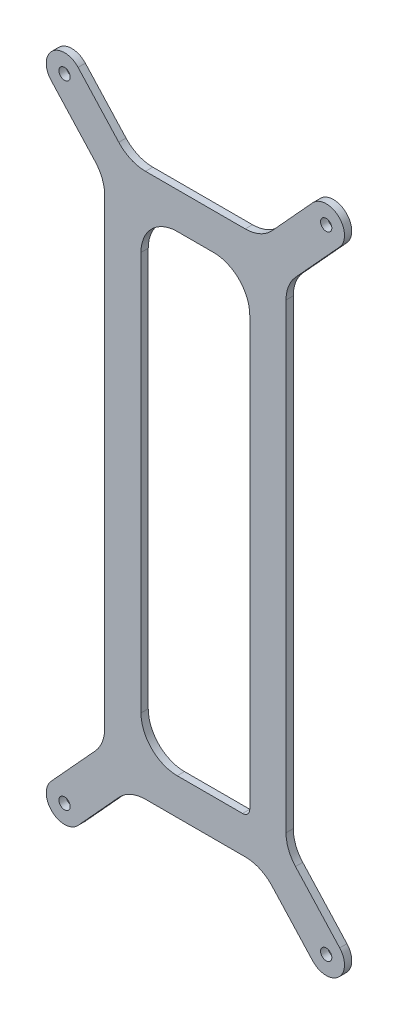
from build123d import *

# Parameters (mm, degrees)
SKETCH1_R           = 1.55
BOSS_EXTRUDE1_DEPTH = 2


with BuildPart() as part:
    # Sketch1 → Boss-Extrude1 (new body)
    with BuildSketch(Plane.XY):
        with BuildLine():
            Line((-25, 63.632566409), (-25, -63.632566409))
            ThreePointArc((-25, -63.632566409), (-25.677155504, -67.24982649), (-27.616914099, -70.377197057))
            Line((-27.616914099, -70.377197057), (-39.807508774, -83.721768816))
            ThreePointArc((-39.807508774, -83.721768816), (-39.485088871, -90.856265673), (-32.350592014, -90.53384577))
            Line((-32.350592014, -90.53384577), (-21.133901666, -78.255369352))
            ThreePointArc((-21.133901666, -78.255369352), (-17.785273196, -75.849964304), (-13.750815765, -75))
            Line((-13.750815765, -75), (13.750815765, -75))
            ThreePointArc((13.750815765, -75), (17.785273196, -75.849964304), (21.133901666, -78.255369352))
            Line((21.133901666, -78.255369352), (32.350592014, -90.53384577))
            ThreePointArc((32.350592014, -90.53384577), (39.485088871, -90.856265673), (39.807508774, -83.721768816))
            Line((39.807508774, -83.721768816), (27.616914099, -70.377197057))
            ThreePointArc((27.616914099, -70.377197057), (25.677155504, -67.24982649), (25, -63.632566409))
            Line((25, -63.632566409), (25, 63.632566409))
            ThreePointArc((25, 63.632566409), (25.677155504, 67.24982649), (27.616914099, 70.377197057))
            Line((27.616914099, 70.377197057), (39.807508774, 83.721768816))
            ThreePointArc((39.807508774, 83.721768816), (39.485088871, 90.856265673), (32.350592014, 90.53384577))
            Line((32.350592014, 90.53384577), (21.133901666, 78.255369352))
            ThreePointArc((21.133901666, 78.255369352), (17.785273196, 75.849964304), (13.750815765, 75))
            Line((13.750815765, 75), (-13.750815765, 75))
            ThreePointArc((-13.750815765, 75), (-17.785273196, 75.849964304), (-21.133901666, 78.255369352))
            Line((-21.133901666, 78.255369352), (-32.350592014, 90.53384577))
            ThreePointArc((-32.350592014, 90.53384577), (-39.485088871, 90.856265673), (-39.807508774, 83.721768816))
            Line((-39.807508774, 83.721768816), (-27.616914099, 70.377197057))
            ThreePointArc((-27.616914099, 70.377197057), (-25.677155504, 67.24982649), (-25, 63.632566409))
        make_face()
        with Locations((-36.079050394, 87.127807293)):
            Circle(SKETCH1_R, mode=Mode.SUBTRACT)
        with Locations((36.079050394, 87.127807293)):
            Circle(SKETCH1_R, mode=Mode.SUBTRACT)
        with Locations((36.079050394, -87.127807293)):
            Circle(SKETCH1_R, mode=Mode.SUBTRACT)
        with Locations((-36.079050394, -87.127807293)):
            Circle(SKETCH1_R, mode=Mode.SUBTRACT)
        with BuildLine():
            Line((-15, 55), (-15, -55))
            ThreePointArc((-15, -55), (-12.071067812, -62.071067812), (-5, -65))
            Line((-5, -65), (5, -65))
            Line((5, -65), (13, -65))
            ThreePointArc((13, -65), (14.414213562, -64.414213562), (15, -63))
            Line((15, -63), (15, -55))
            Line((15, -55), (15, 55))
            ThreePointArc((15, 55), (12.071067812, 62.071067812), (5, 65))
            Line((5, 65), (-5, 65))
            ThreePointArc((-5, 65), (-12.071067812, 62.071067812), (-15, 55))
        make_face(mode=Mode.SUBTRACT)
    extrude(amount=BOSS_EXTRUDE1_DEPTH)


solid = part.part
